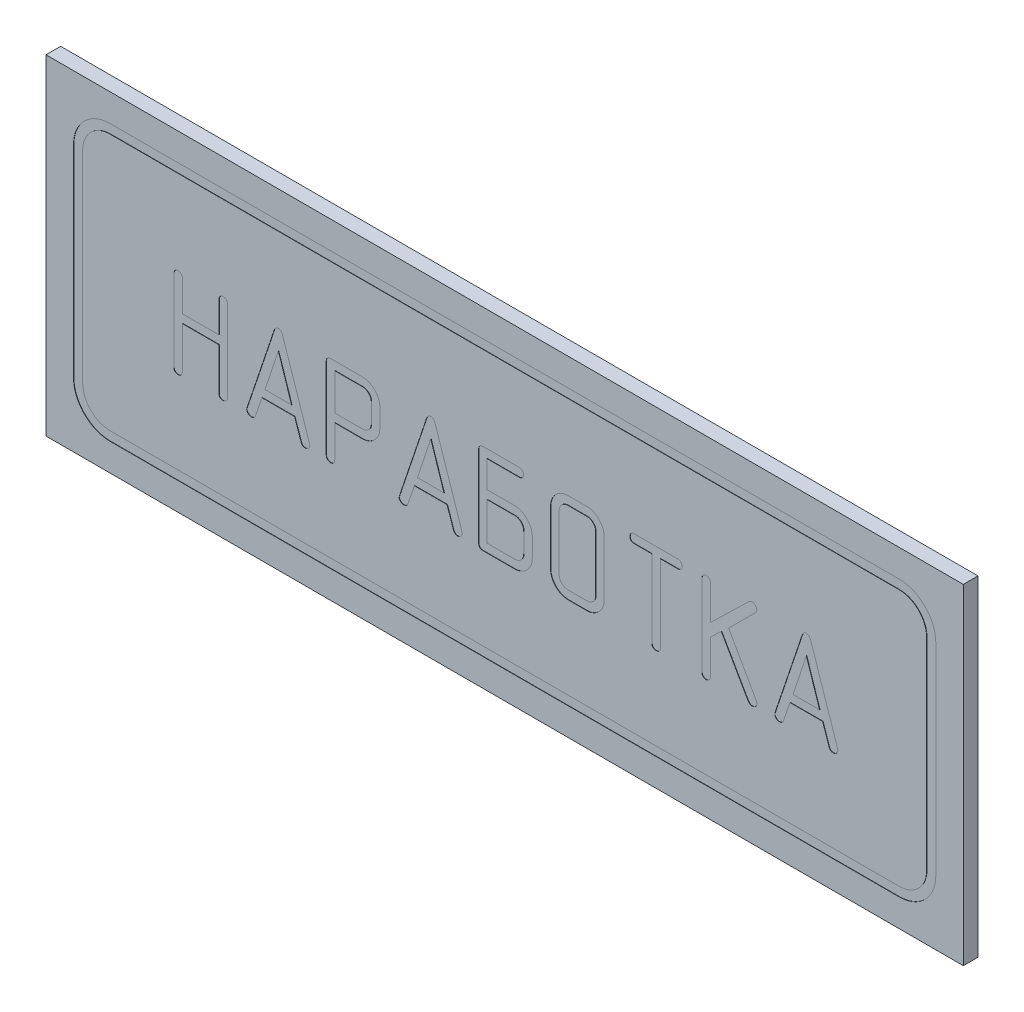
from build123d import *

# Parameters (mm, degrees)
SKETCH_1_W                 = 50
SKETCH_1_H                 = 18
EXTRUDE_1_DEPTH            = 0.8
CUT_EXTRUDE_1_DEPTH        = 0.02
CUT_EXTRUDE_1_2_DEPTH      = 0.02
CUT_EXTRUDE_1_2_DEPTH_BACK = 0.02


with BuildPart() as part:
    # Эскиз1 → Вытянуть1 (new body)
    with BuildSketch(Plane.XY):
        with Locations((25, 9)):
            Rectangle(SKETCH_1_W, SKETCH_1_H)
    extrude(amount=EXTRUDE_1_DEPTH)

    # Эскиз2 → Cut-Extrude 1 (cut)
    # profile 1 of 9: a face of its own
    with BuildSketch(Plane.XY.offset(0.8)):
        with BuildLine():
            Line((9.424559654, 9.491026919), (9.424559654, 11.178672316))
            add(Edge.make_bspline(
                [(9.424559654, 11.178672316), (9.425230619, 11.194361435), (9.426554554, 11.225318933), (9.441016049, 11.269720739), (9.463172562, 11.310878793), (9.493058488, 11.347915035), (9.52907342, 11.378768603), (9.568684269, 11.40202053), (9.611885978, 11.416671576), (9.641846322, 11.417931922), (9.657195081, 11.418577601)],
                knots=[0, 0, 0, 0, 1.015470878, 2.003709671, 2.999333935, 4.038412131, 5.074568827, 6.061528677, 7.006916246, 8, 8, 8, 8], degree=3))
            add(Edge.make_bspline(
                [(9.657195081, 11.418577601), (9.671806604, 11.417713975), (9.700785452, 11.416001157), (9.742750229, 11.40427304), (9.782362537, 11.384761795), (9.819242613, 11.358476614), (9.851420725, 11.323689415), (9.874309812, 11.280087479), (9.888043067, 11.228995795), (9.889214529, 11.192611303), (9.889830508, 11.173479561)],
                knots=[0, 0, 0, 0, 0.924129577, 1.832814461, 2.734077058, 3.706771253, 4.683649099, 5.702831273, 6.792099729, 8, 8, 8, 8], degree=3))
            Line((9.889830508, 11.173479561), (9.889830508, 6.752367896))
            add(Edge.make_bspline(
                [(9.889830508, 6.752367896), (9.889161983, 6.735297536), (9.887843443, 6.701629493), (9.8732574, 6.652769032), (9.850876174, 6.606378576), (9.828485674, 6.579896003), (9.817131938, 6.566467265)],
                knots=[0, 0, 0, 0, 0.999428199, 1.971182286, 2.971230541, 4, 4, 4, 4], degree=3))
            add(Edge.make_bspline(
                [(9.817131938, 6.566467265), (9.803547263, 6.556364856), (9.777768207, 6.537193947), (9.736548908, 6.515948957), (9.695418969, 6.502506484), (9.667674353, 6.500824283), (9.654079428, 6.5)],
                knots=[0, 0, 0, 0, 1.13112399, 2.146485674, 3.091773809, 4, 4, 4, 4], degree=3))
            add(Edge.make_bspline(
                [(9.654079428, 6.5), (9.62522517, 6.502991544), (9.565610901, 6.509172216), (9.516412506, 6.543540845), (9.491026919, 6.56127451)],
                knots=[0, 0, 0, 0, 0.968031924, 2, 2, 2, 2], degree=3))
            add(Edge.make_bspline(
                [(9.491026919, 6.56127451), (9.480645461, 6.572217457), (9.459105187, 6.594922752), (9.439347753, 6.640088561), (9.426443099, 6.692084852), (9.425212974, 6.729422293), (9.424559654, 6.749252243)],
                knots=[0, 0, 0, 0, 0.877029887, 1.819731245, 2.842057225, 4, 4, 4, 4], degree=3))
            Line((9.424559654, 6.749252243), (9.424559654, 9.025756065))
            Line((9.424559654, 9.025756065), (7.430541708, 9.025756065))
            Line((7.430541708, 9.025756065), (7.430541708, 6.752367896))
            add(Edge.make_bspline(
                [(7.430541708, 6.752367896), (7.429808212, 6.733594783), (7.42839134, 6.697331331), (7.415736797, 6.645914549), (7.394956414, 6.5996674), (7.374352326, 6.574052114), (7.364074443, 6.56127451)],
                knots=[0, 0, 0, 0, 1.08719213, 2.100095954, 3.052275931, 4, 4, 4, 4], degree=3))
            add(Edge.make_bspline(
                [(7.364074443, 6.56127451), (7.353033275, 6.551713244), (7.331178486, 6.532787759), (7.290756328, 6.513865257), (7.24597178, 6.502440417), (7.214249791, 6.500829805), (7.197906281, 6.5)],
                knots=[0, 0, 0, 0, 0.96185186, 1.903880948, 2.92005698, 4, 4, 4, 4], degree=3))
            add(Edge.make_bspline(
                [(7.197906281, 6.5), (7.182586406, 6.500791292), (7.152881667, 6.502325581), (7.110073193, 6.514591534), (7.06996603, 6.533223947), (7.033776966, 6.560223677), (7.002520704, 6.594949421), (6.981010906, 6.638772811), (6.966982248, 6.689545166), (6.965860626, 6.725953671), (6.965270854, 6.745098039)],
                knots=[0, 0, 0, 0, 0.965224369, 1.871538615, 2.790145089, 3.742676772, 4.702446452, 5.708824282, 6.795250981, 8, 8, 8, 8], degree=3))
            Line((6.965270854, 6.745098039), (6.965270854, 11.1620555))
            add(Edge.make_bspline(
                [(6.965270854, 11.1620555), (6.965987091, 11.17808376), (6.967429905, 11.210371667), (6.981940178, 11.257357158), (7.003687599, 11.302843998), (7.024299326, 11.329931497), (7.034853772, 11.343801928)],
                knots=[0, 0, 0, 0, 0.966544804, 1.947042782, 2.94876229, 4, 4, 4, 4], degree=3))
            add(Edge.make_bspline(
                [(7.034853772, 11.343801928), (7.046611259, 11.353675097), (7.069669069, 11.37303754), (7.109884442, 11.392688989), (7.152892865, 11.404782934), (7.182590216, 11.406346928), (7.197906281, 11.407153539)],
                knots=[0, 0, 0, 0, 1.025879868, 2.011870596, 2.974645281, 4, 4, 4, 4], degree=3))
            add(Edge.make_bspline(
                [(7.197906281, 11.407153539), (7.212473082, 11.40614918), (7.241275576, 11.404163292), (7.283962735, 11.394501505), (7.322448436, 11.372892208), (7.359977489, 11.348329154), (7.392074618, 11.314363302), (7.415026714, 11.271840511), (7.428758521, 11.221738615), (7.42992694, 11.186034255), (7.430541708, 11.167248255)],
                knots=[0, 0, 0, 0, 0.934259308, 1.847282677, 2.768326902, 3.738884055, 4.710198766, 5.721094328, 6.800944141, 8, 8, 8, 8], degree=3))
            Line((7.430541708, 11.167248255), (7.430541708, 9.491026919))
            Line((7.430541708, 9.491026919), (9.424559654, 9.491026919))
        make_face()
    # profile 2 of 9: a face of its own
    with BuildSketch(Plane.XY.offset(0.8)):
        with BuildLine():
            Line((11.771684945, 7.696410768), (11.41753905, 6.66409106))
            add(Edge.make_bspline(
                [(11.41753905, 6.66409106), (11.406962769, 6.640104595), (11.385775209, 6.592052285), (11.346044654, 6.557705334), (11.32614656, 6.54050349)],
                knots=[0, 0, 0, 0, 0.998348062, 2, 2, 2, 2], degree=3))
            add(Edge.make_bspline(
                [(11.32614656, 6.54050349), (11.307398321, 6.531274628), (11.26536639, 6.510584317), (11.218933593, 6.503773094), (11.193212031, 6.5)],
                knots=[0, 0, 0, 0, 0.892095046, 2, 2, 2, 2], degree=3))
            add(Edge.make_bspline(
                [(11.193212031, 6.5), (11.177181133, 6.500679643), (11.145553818, 6.502020507), (11.100395412, 6.516250083), (11.058540927, 6.538633874), (11.034321216, 6.559063983), (11.021851113, 6.569582918)],
                knots=[0, 0, 0, 0, 1.01257393, 1.997704332, 2.969069762, 4, 4, 4, 4], degree=3))
            add(Edge.make_bspline(
                [(11.021851113, 6.569582918), (11.009484889, 6.580471467), (10.985608309, 6.601494967), (10.959829194, 6.641954612), (10.943515376, 6.687451807), (10.941751587, 6.720028974), (10.940844134, 6.736789631)],
                knots=[0, 0, 0, 0, 1.022890392, 1.974986367, 2.958148861, 4, 4, 4, 4], degree=3))
            Line((10.940844134, 6.736789631), (10.958499501, 6.824027916))
            Line((10.958499501, 6.824027916), (12.434280492, 11.209828847))
            add(Edge.make_bspline(
                [(12.434280492, 11.209828847), (12.447073495, 11.24100291), (12.470465145, 11.298003816), (12.522951067, 11.367932054), (12.590490961, 11.410523876), (12.64007328, 11.415894876), (12.664838817, 11.418577601)],
                knots=[0, 0, 0, 0, 1.213326958, 2.218534511, 3.110187888, 4, 4, 4, 4], degree=3))
            add(Edge.make_bspline(
                [(12.664838817, 11.418577601), (12.689964428, 11.415948454), (12.739924609, 11.410720616), (12.807765941, 11.367929373), (12.860250771, 11.29800469), (12.883642595, 11.241003219), (12.896435693, 11.209828847)],
                knots=[0, 0, 0, 0, 0.899339422, 1.788261434, 2.790389776, 4, 4, 4, 4], degree=3))
            Line((12.896435693, 11.209828847), (14.364946826, 6.824027916))
            Line((14.364946826, 6.824027916), (14.382602193, 6.736789631))
            add(Edge.make_bspline(
                [(14.382602193, 6.736789631), (14.38151305, 6.721453847), (14.379335042, 6.690786189), (14.364196408, 6.645689848), (14.33734589, 6.603823851), (14.313817342, 6.579238407), (14.301595214, 6.566467265)],
                knots=[0, 0, 0, 0, 0.948678786, 1.897115655, 2.907636787, 4, 4, 4, 4], degree=3))
            add(Edge.make_bspline(
                [(14.301595214, 6.566467265), (14.288768687, 6.556279179), (14.263789634, 6.536438368), (14.2211274, 6.515327937), (14.176337423, 6.502447527), (14.145548673, 6.500813011), (14.130234297, 6.5)],
                knots=[0, 0, 0, 0, 1.044588452, 2.034286298, 3.022250655, 4, 4, 4, 4], degree=3))
            add(Edge.make_bspline(
                [(14.130234297, 6.5), (14.112859018, 6.501572019), (14.075291361, 6.504970931), (14.027338489, 6.518689629), (13.987228974, 6.541292188), (13.957953128, 6.57217859), (13.930548479, 6.614061144), (13.914534133, 6.646575647), (13.905907278, 6.66409106)],
                knots=[0, 0, 0, 0, 1.053855164, 2.278574548, 2.982044457, 3.810710099, 4.820639575, 6, 6, 6, 6], degree=3))
            Line((13.905907278, 6.66409106), (13.551761383, 7.696410768))
            Line((13.551761383, 7.696410768), (11.771684945, 7.696410768))
        make_face()
        Polygon((13.386631771, 8.161681622), (12.664838817, 10.355101363), (11.938891658, 8.161681622), align=None, mode=Mode.SUBTRACT)
    # profile 3 of 9: a face of its own
    with BuildSketch(Plane.XY.offset(0.8)):
        with BuildLine():
            Line((15.738949817, 8.494017946), (15.738949817, 6.749252243))
            add(Edge.make_bspline(
                [(15.738949817, 6.749252243), (15.738258549, 6.730467269), (15.736935641, 6.694517668), (15.7239011, 6.643574205), (15.703645483, 6.59773081), (15.682794399, 6.572643045), (15.672482552, 6.560235959)],
                knots=[0, 0, 0, 0, 1.096949031, 2.099277747, 3.060002971, 4, 4, 4, 4], degree=3))
            add(Edge.make_bspline(
                [(15.672482552, 6.560235959), (15.66138872, 6.551090416), (15.639269226, 6.53285553), (15.599200142, 6.513819472), (15.554370008, 6.502453088), (15.52265454, 6.500834113), (15.50631439, 6.5)],
                knots=[0, 0, 0, 0, 0.951182289, 1.896519658, 2.916264364, 4, 4, 4, 4], degree=3))
            add(Edge.make_bspline(
                [(15.50631439, 6.5), (15.490994515, 6.500791292), (15.461289776, 6.502325582), (15.418481299, 6.514591532), (15.37837415, 6.533223952), (15.34218503, 6.560223655), (15.310928984, 6.594949503), (15.289418319, 6.638772476), (15.275300635, 6.689882104), (15.274240919, 6.72664281), (15.273678963, 6.74613659)],
                knots=[0, 0, 0, 0, 0.962602444, 1.866454789, 2.78256597, 3.732510206, 4.689672778, 5.693316895, 6.776792436, 8, 8, 8, 8], degree=3))
            Line((15.273678963, 6.74613659), (15.273678963, 11.17244101))
            add(Edge.make_bspline(
                [(15.273678963, 11.17244101), (15.274446632, 11.191889828), (15.275887644, 11.228397741), (15.287166233, 11.279164576), (15.306226141, 11.322552074), (15.333407333, 11.358422237), (15.368805124, 11.386313572), (15.41208828, 11.405037729), (15.462470327, 11.416307223), (15.498634313, 11.417792815), (15.517738451, 11.418577601)],
                knots=[0, 0, 0, 0, 1.174787525, 2.205226063, 3.123069814, 4.018700482, 4.897801082, 5.815644833, 6.846083372, 8, 8, 8, 8], degree=3))
            Line((15.517738451, 11.418577601), (17.223039216, 11.418577601))
            add(Edge.make_bspline(
                [(17.223039216, 11.418577601), (17.256317621, 11.417866327), (17.322119704, 11.416459912), (17.418896122, 11.402663715), (17.511683906, 11.379685699), (17.600363719, 11.348372687), (17.685722668, 11.308809347), (17.766338678, 11.258542593), (17.843515018, 11.200147895), (17.916034393, 11.133927127), (17.981635515, 11.061120683), (18.039074802, 10.983741817), (18.088419374, 10.903261367), (18.12924358, 10.818894126), (18.160636109, 10.730068377), (18.1818777, 10.637329406), (18.196227834, 10.541448425), (18.197563218, 10.476318891), (18.198238617, 10.443378199)],
                knots=[0, 0, 0, 0, 1.040150937, 2.0567121, 3.049181958, 4.02498047, 4.993546281, 5.985011943, 6.989628837, 8.016398882, 9.05118425, 10.049305898, 11.025884737, 11.99909771, 12.974896222, 13.964824085, 14.970665092, 16, 16, 16, 16], degree=3))
            Line((18.198238617, 10.443378199), (18.198238617, 9.469217348))
            add(Edge.make_bspline(
                [(18.198238617, 9.469217348), (18.197541876, 9.436284843), (18.196171551, 9.371514402), (18.182280204, 9.276103507), (18.158990333, 9.18451968), (18.128644036, 9.09541086), (18.08566506, 9.011619853), (18.037625905, 8.92932779), (17.977244718, 8.852874114), (17.910581415, 8.779631782), (17.837571933, 8.712440888), (17.7595048, 8.654159704), (17.677684851, 8.604904146), (17.592595401, 8.564168413), (17.503346977, 8.53296643), (17.410595576, 8.509916235), (17.313809257, 8.496139679), (17.248008528, 8.494730578), (17.214730808, 8.494017946)],
                knots=[0, 0, 0, 0, 1.02623101, 2.018353406, 2.997356446, 3.970212496, 4.945221414, 5.928083838, 6.936220983, 7.975143232, 9.014065481, 10.02428031, 11.007142734, 11.987156619, 12.960012669, 13.949489793, 14.962985576, 16, 16, 16, 16], degree=3))
            Line((17.214730808, 8.494017946), (15.738949817, 8.494017946))
        make_face()
        with BuildLine():
            Line((15.738949817, 8.9592888), (17.234463277, 8.9592888))
            add(Edge.make_bspline(
                [(17.234463277, 8.9592888), (17.267880159, 8.96069442), (17.333031328, 8.963434883), (17.426728405, 8.990614668), (17.512080846, 9.035230073), (17.588891484, 9.095373354), (17.653611401, 9.169516663), (17.699991395, 9.256549489), (17.728006489, 9.353968984), (17.731271176, 9.422288892), (17.732967763, 9.457793287)],
                knots=[0, 0, 0, 0, 1.016449325, 1.981718699, 2.944447279, 3.936507135, 4.939060545, 5.920968299, 6.919571676, 8, 8, 8, 8], degree=3))
            Line((17.732967763, 9.457793287), (17.732967763, 10.45480226))
            add(Edge.make_bspline(
                [(17.732967763, 10.45480226), (17.731693255, 10.488609655), (17.729204598, 10.554623393), (17.700119913, 10.648773573), (17.656899587, 10.735985759), (17.593485998, 10.810651026), (17.519886987, 10.87489778), (17.433110297, 10.920366407), (17.336898571, 10.948174225), (17.269274376, 10.951562536), (17.234463277, 10.953306746)],
                knots=[0, 0, 0, 0, 1.02750581, 2.006350931, 2.978970947, 3.976537614, 4.972762713, 5.940903496, 6.940033048, 8, 8, 8, 8], degree=3))
            Line((17.234463277, 10.953306746), (15.738949817, 10.953306746))
            Line((15.738949817, 10.953306746), (15.738949817, 8.9592888))
        make_face(mode=Mode.SUBTRACT)
    # profile 4 of 9: a face of its own
    with BuildSketch(Plane.XY.offset(0.8)):
        with BuildLine():
            Line((20.080093054, 7.696410768), (19.725947159, 6.66409106))
            add(Edge.make_bspline(
                [(19.725947159, 6.66409106), (19.715370878, 6.640104595), (19.694183318, 6.592052285), (19.654452763, 6.557705334), (19.634554669, 6.54050349)],
                knots=[0, 0, 0, 0, 0.998348062, 2, 2, 2, 2], degree=3))
            add(Edge.make_bspline(
                [(19.634554669, 6.54050349), (19.61580643, 6.531274628), (19.573774499, 6.510584317), (19.527341702, 6.503773094), (19.50162014, 6.5)],
                knots=[0, 0, 0, 0, 0.892095046, 2, 2, 2, 2], degree=3))
            add(Edge.make_bspline(
                [(19.50162014, 6.5), (19.485589242, 6.500679643), (19.453961927, 6.502020507), (19.408803521, 6.516250083), (19.366949036, 6.538633874), (19.342729325, 6.559063983), (19.330259222, 6.569582918)],
                knots=[0, 0, 0, 0, 1.01257393, 1.997704332, 2.969069762, 4, 4, 4, 4], degree=3))
            add(Edge.make_bspline(
                [(19.330259222, 6.569582918), (19.317892998, 6.580471467), (19.294016418, 6.601494967), (19.268237303, 6.641954612), (19.251923485, 6.687451807), (19.250159696, 6.720028974), (19.249252243, 6.736789631)],
                knots=[0, 0, 0, 0, 1.022890392, 1.974986367, 2.958148861, 4, 4, 4, 4], degree=3))
            Line((19.249252243, 6.736789631), (19.266907611, 6.824027916))
            Line((19.266907611, 6.824027916), (20.742688601, 11.209828847))
            add(Edge.make_bspline(
                [(20.742688601, 11.209828847), (20.755481604, 11.24100291), (20.778873254, 11.298003816), (20.831359176, 11.367932054), (20.89889907, 11.410523876), (20.948481389, 11.415894876), (20.973246926, 11.418577601)],
                knots=[0, 0, 0, 0, 1.213326958, 2.218534511, 3.110187888, 4, 4, 4, 4], degree=3))
            add(Edge.make_bspline(
                [(20.973246926, 11.418577601), (20.998372537, 11.415948454), (21.048332718, 11.410720616), (21.11617405, 11.367929373), (21.16865888, 11.29800469), (21.192050704, 11.241003219), (21.204843802, 11.209828847)],
                knots=[0, 0, 0, 0, 0.899339422, 1.788261434, 2.790389776, 4, 4, 4, 4], degree=3))
            Line((21.204843802, 11.209828847), (22.673354935, 6.824027916))
            Line((22.673354935, 6.824027916), (22.691010302, 6.736789631))
            add(Edge.make_bspline(
                [(22.691010302, 6.736789631), (22.689921159, 6.721453847), (22.687743151, 6.690786189), (22.672604517, 6.645689848), (22.645753999, 6.603823851), (22.622225451, 6.579238407), (22.610003323, 6.566467265)],
                knots=[0, 0, 0, 0, 0.948678786, 1.897115655, 2.907636787, 4, 4, 4, 4], degree=3))
            add(Edge.make_bspline(
                [(22.610003323, 6.566467265), (22.597176796, 6.556279179), (22.572197743, 6.536438368), (22.529535509, 6.515327937), (22.484745532, 6.502447527), (22.453956782, 6.500813011), (22.438642406, 6.5)],
                knots=[0, 0, 0, 0, 1.044588452, 2.034286298, 3.022250655, 4, 4, 4, 4], degree=3))
            add(Edge.make_bspline(
                [(22.438642406, 6.5), (22.421267127, 6.501572019), (22.38369947, 6.504970931), (22.335746598, 6.518689629), (22.295637083, 6.541292188), (22.266361237, 6.57217859), (22.238956588, 6.614061144), (22.222942242, 6.646575647), (22.214315387, 6.66409106)],
                knots=[0, 0, 0, 0, 1.053855164, 2.278574548, 2.982044457, 3.810710099, 4.820639575, 6, 6, 6, 6], degree=3))
            Line((22.214315387, 6.66409106), (21.860169492, 7.696410768))
            Line((21.860169492, 7.696410768), (20.080093054, 7.696410768))
        make_face()
        Polygon((21.69503988, 8.161681622), (20.973246926, 10.355101363), (20.247299767, 8.161681622), align=None, mode=Mode.SUBTRACT)
    # profile 5 of 9: a face of its own
    with BuildSketch(Plane.XY.offset(0.8)):
        with BuildLine():
            Line((24.047357926, 9.491026919), (25.523138917, 9.491026919))
            add(Edge.make_bspline(
                [(25.523138917, 9.491026919), (25.556076061, 9.490341654), (25.620855625, 9.488993899), (25.716200124, 9.474938303), (25.808144451, 9.452230872), (25.896593075, 9.419505786), (25.982254447, 9.379323721), (26.063772102, 9.328715903), (26.141951454, 9.26919043), (26.215824921, 9.201235053), (26.28370407, 9.127336415), (26.343725725, 9.049091952), (26.393536043, 8.96626643), (26.435882919, 8.880166538), (26.466651078, 8.788803025), (26.489392242, 8.693931019), (26.504869455, 8.595260556), (26.506050135, 8.528002898), (26.506646726, 8.494017946)],
                knots=[0, 0, 0, 0, 1.015136754, 1.996533632, 2.964952983, 3.930897514, 4.900316782, 5.87810664, 6.883824193, 7.926598939, 8.969373685, 9.975091237, 10.961989424, 11.945648457, 12.928148061, 13.927669877, 14.952862161, 16, 16, 16, 16], degree=3))
            Line((26.506646726, 8.494017946), (26.506646726, 7.497008973))
            add(Edge.make_bspline(
                [(26.506646726, 7.497008973), (26.505956814, 7.463381833), (26.504599575, 7.397228419), (26.490603318, 7.299799203), (26.467798547, 7.206286741), (26.436222837, 7.116340072), (26.396941189, 7.029169049), (26.346644824, 6.946478143), (26.288252045, 6.867245606), (26.222114722, 6.792549068), (26.148833209, 6.725153759), (26.072507913, 6.664200887), (25.991287394, 6.614103095), (25.907033554, 6.572107265), (25.818187279, 6.539676543), (25.725441589, 6.517470183), (25.629603162, 6.501733449), (25.564399872, 6.500581948), (25.531447325, 6.5)],
                knots=[0, 0, 0, 0, 1.040842045, 2.047609564, 3.040929158, 4.017443261, 4.996132558, 5.99637111, 7.008490481, 8.041295016, 9.080589833, 10.08861246, 11.061411662, 12.029947816, 12.999966318, 13.982874629, 14.980581801, 16, 16, 16, 16], degree=3))
            Line((25.531447325, 6.5), (23.82614656, 6.5))
            add(Edge.make_bspline(
                [(23.82614656, 6.5), (23.807042422, 6.500784785), (23.770878436, 6.502270378), (23.720496389, 6.513539872), (23.677213233, 6.532264028), (23.641815442, 6.560155364), (23.61463425, 6.596025527), (23.595574342, 6.639413025), (23.584295753, 6.690179859), (23.582854741, 6.726687772), (23.582087072, 6.74613659)],
                knots=[0, 0, 0, 0, 1.153916628, 2.184355167, 3.102198918, 3.981299518, 4.876930186, 5.794773937, 6.825212475, 8, 8, 8, 8], degree=3))
            Line((23.582087072, 6.74613659), (23.582087072, 11.17244101))
            add(Edge.make_bspline(
                [(23.582087072, 11.17244101), (23.582854629, 11.19189009), (23.584295432, 11.228398493), (23.595575396, 11.279162112), (23.614630799, 11.322560145), (23.641827933, 11.358393025), (23.677417632, 11.386621513), (23.721302327, 11.404790047), (23.771893896, 11.41636003), (23.808072991, 11.417811069), (23.827185111, 11.418577601)],
                knots=[0, 0, 0, 0, 1.171986281, 2.199967772, 3.115622954, 4.009118019, 4.886122432, 5.820853358, 6.848834849, 8, 8, 8, 8], degree=3))
            Line((23.827185111, 11.418577601), (25.790046527, 11.418577601))
            add(Edge.make_bspline(
                [(25.790046527, 11.418577601), (25.806409627, 11.417877326), (25.838688458, 11.416495923), (25.885194362, 11.402526121), (25.927284466, 11.379074741), (25.964602373, 11.347996866), (25.994697998, 11.311199735), (26.01889373, 11.27221731), (26.032963302, 11.229806618), (26.034416727, 11.200578753), (26.035144566, 11.185942173)],
                knots=[0, 0, 0, 0, 1.049035914, 2.069391155, 3.084643979, 4.126821057, 5.168998136, 6.1263312, 7.061713754, 8, 8, 8, 8], degree=3))
            add(Edge.make_bspline(
                [(26.035144566, 11.185942173), (26.031744869, 11.159090688), (26.024506691, 11.101922134), (25.983933375, 11.038018412), (25.938764412, 10.994161363), (25.894844608, 10.969602034), (25.843071823, 10.956354212), (25.806393821, 10.954363242), (25.786930874, 10.953306746)],
                knots=[0, 0, 0, 0, 1.274870288, 2.714281576, 3.482672865, 4.256333186, 5.074734361, 6, 6, 6, 6], degree=3))
            Line((25.786930874, 10.953306746), (24.047357926, 10.953306746))
            Line((24.047357926, 10.953306746), (24.047357926, 9.491026919))
        make_face()
        with BuildLine():
            Line((24.047357926, 9.025756065), (24.047357926, 6.965270854))
            Line((24.047357926, 6.965270854), (25.542871386, 6.965270854))
            add(Edge.make_bspline(
                [(25.542871386, 6.965270854), (25.576306606, 6.96701761), (25.641560995, 6.970426694), (25.735189523, 6.998762483), (25.820883167, 7.044303891), (25.897326587, 7.10673668), (25.962433936, 7.183020889), (26.008381709, 7.27307597), (26.036411314, 7.373495582), (26.039678854, 7.443852051), (26.041375872, 7.480392157)],
                knots=[0, 0, 0, 0, 1.001355613, 1.954311872, 2.906702074, 3.896084438, 4.898677921, 5.892682449, 6.905550428, 8, 8, 8, 8], degree=3))
            Line((26.041375872, 7.480392157), (26.041375872, 8.510634762))
            add(Edge.make_bspline(
                [(26.041375872, 8.510634762), (26.040027455, 8.545446649), (26.037381073, 8.613767936), (26.009305648, 8.711075972), (25.96469699, 8.800279609), (25.902410676, 8.877811303), (25.828347074, 8.94399721), (25.741911265, 8.991890948), (25.645434231, 9.020825551), (25.577692879, 9.024082088), (25.542871386, 9.025756065)],
                knots=[0, 0, 0, 0, 1.041747408, 2.044517874, 3.010480817, 4.015989705, 5.009469057, 5.971685018, 6.957373109, 8, 8, 8, 8], degree=3))
            Line((25.542871386, 9.025756065), (24.047357926, 9.025756065))
        make_face(mode=Mode.SUBTRACT)
    # profile 6 of 9: a face of its own
    with BuildSketch(Plane.XY.offset(0.8)):
        with BuildLine():
            add(Edge.make_bspline(
                [(30.428215354, 7.48350781), (30.427516924, 7.450228514), (30.426143101, 7.384767657), (30.412320327, 7.288673599), (30.389175821, 7.196627011), (30.357805664, 7.108010017), (30.318485822, 7.021878151), (30.268196345, 6.940227237), (30.209799531, 6.862028073), (30.143641678, 6.788395316), (30.070438755, 6.721921487), (29.993716579, 6.662278447), (29.913172928, 6.611752194), (29.828305383, 6.571307441), (29.739784952, 6.538646443), (29.647100312, 6.516106858), (29.551072599, 6.502079509), (29.485952083, 6.500698484), (29.453015952, 6.5)],
                knots=[0, 0, 0, 0, 1.037122832, 2.040035617, 3.019141001, 3.992098752, 4.967627701, 5.965415826, 6.975736262, 8.007509145, 9.046540002, 10.054782536, 11.034185367, 12.004565107, 12.981168362, 13.970748924, 14.973661709, 16, 16, 16, 16], degree=3))
            Line((29.453015952, 6.5), (28.478855101, 6.5))
            add(Edge.make_bspline(
                [(28.478855101, 6.5), (28.446269403, 6.500715269), (28.381846517, 6.502129377), (28.287115722, 6.515863044), (28.195833769, 6.539237278), (28.10778843, 6.570225599), (28.022538763, 6.609441677), (27.942558855, 6.660666653), (27.864588939, 6.718329687), (27.791043932, 6.784613726), (27.724285209, 6.857908154), (27.664728456, 6.935270235), (27.615574844, 7.017460918), (27.57488756, 7.103002412), (27.542318421, 7.192612374), (27.519757006, 7.286314525), (27.50568772, 7.383722947), (27.504340513, 7.449879217), (27.5036557, 7.48350781)],
                knots=[0, 0, 0, 0, 1.015308535, 2.007294869, 2.975697998, 3.948420628, 4.913933354, 5.893099506, 6.903175791, 7.93469934, 8.973479108, 9.990048541, 10.972776172, 11.952655656, 12.939168026, 13.938988876, 14.952345666, 16, 16, 16, 16], degree=3))
            Line((27.5036557, 7.48350781), (27.5036557, 10.435069791))
            add(Edge.make_bspline(
                [(27.5036557, 10.435069791), (27.504316674, 10.468703194), (27.505616983, 10.534868927), (27.520015865, 10.63212872), (27.54125895, 10.72589661), (27.572633347, 10.815764481), (27.613498272, 10.901138878), (27.662522066, 10.982536543), (27.720249729, 11.060106164), (27.786186898, 11.132885174), (27.858075138, 11.200094959), (27.935241012, 11.258758639), (28.016764189, 11.307352672), (28.101204259, 11.348697255), (28.190261199, 11.379583553), (28.282984196, 11.402691872), (28.379778244, 11.41645261), (28.445577916, 11.417863875), (28.478855101, 11.418577601)],
                knots=[0, 0, 0, 0, 1.045837316, 2.057436573, 3.05302036, 4.034221007, 5.012401019, 5.993424239, 6.986673985, 8.016408493, 9.045466582, 10.04517987, 11.026203091, 11.994665743, 12.965701314, 13.953326856, 14.964926113, 16, 16, 16, 16], degree=3))
            Line((28.478855101, 11.418577601), (29.453015952, 11.418577601))
            add(Edge.make_bspline(
                [(29.453015952, 11.418577601), (29.486292096, 11.417861799), (29.552089708, 11.416446431), (29.648898817, 11.402715701), (29.741566469, 11.379497106), (29.830969683, 11.348964701), (29.914778134, 11.306018535), (29.997024104, 11.257924596), (30.073449948, 11.197893766), (30.145690061, 11.130846768), (30.211977522, 11.057937242), (30.26901757, 10.979526354), (30.318444625, 10.898066834), (30.358994886, 10.812901665), (30.390635854, 10.723850974), (30.411962446, 10.630764905), (30.426188664, 10.534171336), (30.427534645, 10.468355268), (30.428215354, 10.435069791)],
                knots=[0, 0, 0, 0, 1.035817767, 2.048144033, 3.036479355, 4.008212784, 4.982096596, 5.963824851, 6.970798663, 8.000596308, 9.031070859, 10.033707362, 11.015435617, 11.994318621, 12.966052049, 13.951855967, 14.964182233, 16, 16, 16, 16], degree=3))
            Line((30.428215354, 10.435069791), (30.428215354, 7.48350781))
        make_face()
        with BuildLine():
            Line((29.9629445, 7.463775341), (29.9629445, 10.45480226))
            add(Edge.make_bspline(
                [(29.9629445, 10.45480226), (29.961669992, 10.488609655), (29.959181334, 10.554623393), (29.93009665, 10.648773573), (29.886876323, 10.735985759), (29.823462735, 10.810651026), (29.749863723, 10.87489778), (29.663087034, 10.920366407), (29.566875307, 10.948174225), (29.499251112, 10.951562536), (29.464440013, 10.953306746)],
                knots=[0, 0, 0, 0, 1.02750581, 2.006350931, 2.978970947, 3.976537614, 4.972762713, 5.940903496, 6.940033048, 8, 8, 8, 8], degree=3))
            Line((29.464440013, 10.953306746), (28.46743104, 10.953306746))
            add(Edge.make_bspline(
                [(28.46743104, 10.953306746), (28.433680413, 10.95142101), (28.367568077, 10.94772714), (28.272297454, 10.921213482), (28.184939803, 10.876067305), (28.136017725, 10.832910976), (28.111208043, 10.811025258)],
                knots=[0, 0, 0, 0, 1.029004864, 2.015663768, 2.993690518, 4, 4, 4, 4], degree=3))
            add(Edge.make_bspline(
                [(28.111208043, 10.811025258), (28.089278864, 10.786237489), (28.045832713, 10.737127894), (28.001272714, 10.649107154), (27.974560263, 10.553984606), (27.970824225, 10.488211061), (27.968926554, 10.45480226)],
                knots=[0, 0, 0, 0, 1.00659897, 1.994276692, 2.98121943, 4, 4, 4, 4], degree=3))
            Line((27.968926554, 10.45480226), (27.968926554, 7.463775341))
            add(Edge.make_bspline(
                [(27.968926554, 7.463775341), (27.97081229, 7.430024714), (27.97450616, 7.363912377), (28.001019818, 7.268641755), (28.046165995, 7.181284103), (28.089322324, 7.132362025), (28.111208043, 7.107552343)],
                knots=[0, 0, 0, 0, 1.029004864, 2.015663768, 2.993690518, 4, 4, 4, 4], degree=3))
            add(Edge.make_bspline(
                [(28.111208043, 7.107552343), (28.136609, 7.0869767), (28.186659881, 7.046433777), (28.243266361, 7.015711987), (28.271144899, 7.000581589)],
                knots=[0, 0, 0, 0, 1.015005409, 2, 2, 2, 2], degree=3))
            add(Edge.make_bspline(
                [(28.271144899, 7.000581589), (28.305178342, 6.990564901), (28.369359212, 6.971675254), (28.436087177, 6.967317707), (28.46743104, 6.965270854)],
                knots=[0, 0, 0, 0, 1.06054792, 2, 2, 2, 2], degree=3))
            Line((28.46743104, 6.965270854), (29.464440013, 6.965270854))
            add(Edge.make_bspline(
                [(29.464440013, 6.965270854), (29.497856896, 6.966676473), (29.563008064, 6.969416937), (29.656705141, 6.996596722), (29.742057582, 7.041212126), (29.81886822, 7.101355408), (29.883588138, 7.175498717), (29.929968132, 7.262531543), (29.957983225, 7.359951038), (29.961247912, 7.428270945), (29.9629445, 7.463775341)],
                knots=[0, 0, 0, 0, 1.016449325, 1.981718699, 2.944447279, 3.936507135, 4.939060545, 5.920968299, 6.919571676, 8, 8, 8, 8], degree=3))
        make_face(mode=Mode.SUBTRACT)
    # profile 7 of 9: a face of its own
    with BuildSketch(Plane.XY.offset(0.8)):
        with BuildLine():
            Line((33.020438684, 10.953306746), (32.062894649, 10.953306746))
            add(Edge.make_bspline(
                [(32.062894649, 10.953306746), (32.045508252, 10.954106073), (32.012064678, 10.955643615), (31.964216347, 10.967442742), (31.920693174, 10.986545218), (31.897012415, 11.006694609), (31.885302426, 11.016658358)],
                knots=[0, 0, 0, 0, 1.079416544, 2.076309691, 3.048747018, 4, 4, 4, 4], degree=3))
            add(Edge.make_bspline(
                [(31.885302426, 11.016658358), (31.875806575, 11.029510391), (31.857452143, 11.054351951), (31.838399513, 11.096364262), (31.826582113, 11.140288239), (31.824884257, 11.170635869), (31.824027916, 11.185942173)],
                knots=[0, 0, 0, 0, 1.042916738, 2.015842924, 2.999259183, 4, 4, 4, 4], degree=3))
            add(Edge.make_bspline(
                [(31.824027916, 11.185942173), (31.827079325, 11.212753809), (31.833510169, 11.269259345), (31.872427261, 11.333141752), (31.916353378, 11.376128801), (31.957877888, 11.402790717), (32.008222584, 11.415215813), (32.043463401, 11.417424733), (32.061856098, 11.418577601)],
                knots=[0, 0, 0, 0, 1.300166254, 2.740100978, 3.513473502, 4.283912407, 5.104348798, 6, 6, 6, 6], degree=3))
            Line((32.061856098, 11.418577601), (34.444292124, 11.418577601))
            add(Edge.make_bspline(
                [(34.444292124, 11.418577601), (34.460323598, 11.41792076), (34.491620035, 11.416638484), (34.536631659, 11.402263105), (34.577430946, 11.379060019), (34.6136743, 11.347929227), (34.64286668, 11.311204605), (34.66570333, 11.271928361), (34.679994393, 11.229836974), (34.681410936, 11.200588883), (34.682120306, 11.185942173)],
                knots=[0, 0, 0, 0, 1.043365491, 2.036844728, 3.048657267, 4.090308507, 5.13489674, 6.096248124, 7.046648906, 8, 8, 8, 8], degree=3))
            add(Edge.make_bspline(
                [(34.682120306, 11.185942173), (34.679126518, 11.159071398), (34.672764121, 11.101965626), (34.632626861, 11.038816782), (34.590077066, 10.994234541), (34.54786712, 10.969388061), (34.497653648, 10.956479441), (34.462017367, 10.954401079), (34.443253573, 10.953306746)],
                knots=[0, 0, 0, 0, 1.296042091, 2.754348639, 3.513317893, 4.272657647, 5.090491591, 6, 6, 6, 6], degree=3))
            Line((34.443253573, 10.953306746), (33.485709538, 10.953306746))
            Line((33.485709538, 10.953306746), (33.485709538, 6.747175141))
            add(Edge.make_bspline(
                [(33.485709538, 6.747175141), (33.484976751, 6.728746768), (33.483561823, 6.693163682), (33.47090824, 6.642762396), (33.450091133, 6.59753945), (33.429516489, 6.57265989), (33.419242273, 6.560235959)],
                knots=[0, 0, 0, 0, 1.08722023, 2.099298278, 3.050859919, 4, 4, 4, 4], degree=3))
            add(Edge.make_bspline(
                [(33.419242273, 6.560235959), (33.408148441, 6.551090416), (33.386028947, 6.53285553), (33.345959863, 6.513819472), (33.301129729, 6.502453088), (33.269414261, 6.500834113), (33.253074111, 6.5)],
                knots=[0, 0, 0, 0, 0.951182289, 1.896519658, 2.916264364, 4, 4, 4, 4], degree=3))
            add(Edge.make_bspline(
                [(33.253074111, 6.5), (33.237755262, 6.500792171), (33.208052513, 6.502328166), (33.165229747, 6.514581874), (33.125177549, 6.533261375), (33.088562075, 6.560234225), (33.058019, 6.59593377), (33.036115362, 6.639757453), (33.022078968, 6.690936563), (33.021007089, 6.727686874), (33.020438684, 6.747175141)],
                knots=[0, 0, 0, 0, 0.960624492, 1.862619603, 2.776848362, 3.724840655, 4.696474829, 5.698056661, 6.779305879, 8, 8, 8, 8], degree=3))
            Line((33.020438684, 6.747175141), (33.020438684, 10.953306746))
        make_face()
    # profile 8 of 9: a face of its own
    with BuildSketch(Plane.XY.offset(0.8)):
        with BuildLine():
            Line((36.210867398, 9.302010635), (38.318087404, 11.352110336))
            add(Edge.make_bspline(
                [(38.318087404, 11.352110336), (38.330542361, 11.362331179), (38.355001572, 11.38240301), (38.397543493, 11.403212068), (38.442634624, 11.416239252), (38.473781984, 11.417795065), (38.489448322, 11.418577601)],
                knots=[0, 0, 0, 0, 1.025751183, 2.014383971, 3.001285135, 4, 4, 4, 4], degree=3))
            add(Edge.make_bspline(
                [(38.489448322, 11.418577601), (38.504759287, 11.417385992), (38.535602144, 11.414985581), (38.581232595, 11.401294789), (38.624188446, 11.376469903), (38.663943713, 11.343567828), (38.698338682, 11.305153719), (38.726338424, 11.262838102), (38.740506798, 11.215191793), (38.742763382, 11.182552941), (38.74389332, 11.166209704)],
                knots=[0, 0, 0, 0, 0.934203003, 1.8818859, 2.873627656, 3.937884265, 5.01357923, 6.008680934, 7.002887762, 8, 8, 8, 8], degree=3))
            add(Edge.make_bspline(
                [(38.74389332, 11.166209704), (38.743103876, 11.154649843), (38.741374932, 11.129332825), (38.72437551, 11.090754446), (38.701833073, 11.046659052), (38.681301749, 11.017117111), (38.670156198, 11.001080093)],
                knots=[0, 0, 0, 0, 0.75327487, 1.649731969, 2.724143087, 4, 4, 4, 4], degree=3))
            Line((38.670156198, 11.001080093), (37.207876371, 9.539838817))
            Line((37.207876371, 9.539838817), (38.714813892, 6.86868561))
            Line((38.714813892, 6.86868561), (38.750124626, 6.738866733))
            add(Edge.make_bspline(
                [(38.750124626, 6.738866733), (38.749198988, 6.723466427), (38.747360785, 6.692883316), (38.730076881, 6.649401504), (38.705603051, 6.607446646), (38.680907103, 6.585261121), (38.668079096, 6.573737122)],
                knots=[0, 0, 0, 0, 0.966715818, 1.919778525, 2.919454473, 4, 4, 4, 4], degree=3))
            add(Edge.make_bspline(
                [(38.668079096, 6.573737122), (38.655361829, 6.562377272), (38.630349397, 6.540034617), (38.585256081, 6.517477705), (38.536904579, 6.50162439), (38.50273832, 6.50054904), (38.485294118, 6.5)],
                knots=[0, 0, 0, 0, 1.007531264, 1.981621398, 2.969480274, 4, 4, 4, 4], degree=3))
            add(Edge.make_bspline(
                [(38.485294118, 6.5), (38.46528818, 6.501597156), (38.425519325, 6.504772066), (38.368999596, 6.531188765), (38.316982698, 6.572766506), (38.289223721, 6.610017745), (38.274468262, 6.629818877)],
                knots=[0, 0, 0, 0, 0.927963832, 1.844655289, 2.854312906, 4, 4, 4, 4], degree=3))
            Line((38.274468262, 6.629818877), (36.808034231, 9.188808574))
            Line((36.808034231, 9.188808574), (36.210867398, 8.613451313))
            Line((36.210867398, 8.613451313), (36.210867398, 6.745098039))
            add(Edge.make_bspline(
                [(36.210867398, 6.745098039), (36.21017347, 6.726660479), (36.208846234, 6.691395976), (36.195861081, 6.641431383), (36.175264489, 6.596497116), (36.15467951, 6.571620079), (36.144400133, 6.559197408)],
                knots=[0, 0, 0, 0, 1.092637599, 2.089827516, 3.046130571, 4, 4, 4, 4], degree=3))
            add(Edge.make_bspline(
                [(36.144400133, 6.559197408), (36.1332998, 6.550078409), (36.111167345, 6.531896447), (36.071272237, 6.512491314), (36.0261182, 6.502804671), (35.994542413, 6.500955294), (35.978231971, 6.5)],
                knots=[0, 0, 0, 0, 0.952479984, 1.899107072, 2.914785828, 4, 4, 4, 4], degree=3))
            add(Edge.make_bspline(
                [(35.978231971, 6.5), (35.962913122, 6.500792171), (35.933210372, 6.502328165), (35.890387609, 6.514581875), (35.850335398, 6.53326137), (35.813719977, 6.560234245), (35.783176695, 6.595933694), (35.76127388, 6.639757756), (35.747326177, 6.690599308), (35.746192602, 6.726997595), (35.745596544, 6.74613659)],
                knots=[0, 0, 0, 0, 0.963235638, 1.86768253, 2.784396324, 3.734965427, 4.709240672, 5.71354498, 6.797733224, 8, 8, 8, 8], degree=3))
            Line((35.745596544, 6.74613659), (35.745596544, 11.179710867))
            add(Edge.make_bspline(
                [(35.745596544, 11.179710867), (35.746331885, 11.195032085), (35.747798979, 11.225599772), (35.761614523, 11.269799557), (35.785703262, 11.310043109), (35.81644476, 11.346982446), (35.852636987, 11.378195154), (35.891993294, 11.402281305), (35.934358467, 11.416407631), (35.963592368, 11.417853531), (35.978231971, 11.418577601)],
                knots=[0, 0, 0, 0, 0.999236149, 1.99359732, 2.986671625, 4.046521611, 5.120990907, 6.094558121, 7.045802594, 8, 8, 8, 8], degree=3))
            add(Edge.make_bspline(
                [(35.978231971, 11.418577601), (36.007399465, 11.416364977), (36.06659554, 11.411874408), (36.116147898, 11.379114214), (36.14128448, 11.362495846)],
                knots=[0, 0, 0, 0, 0.985453645, 2, 2, 2, 2], degree=3))
            add(Edge.make_bspline(
                [(36.14128448, 11.362495846), (36.151988007, 11.351556149), (36.173914845, 11.329145504), (36.194829514, 11.28518939), (36.209224275, 11.23532418), (36.210300918, 11.199564516), (36.210867398, 11.180749418)],
                knots=[0, 0, 0, 0, 0.910929471, 1.866095324, 2.877237029, 4, 4, 4, 4], degree=3))
            Line((36.210867398, 11.180749418), (36.210867398, 9.302010635))
        make_face()
    # profile 9 of 9: a face of its own
    with BuildSketch(Plane.XY.offset(0.8)):
        with BuildLine():
            Line((40.552010635, 7.696410768), (40.197864739, 6.66409106))
            add(Edge.make_bspline(
                [(40.197864739, 6.66409106), (40.187288459, 6.640104595), (40.166100898, 6.592052285), (40.126370344, 6.557705334), (40.10647225, 6.54050349)],
                knots=[0, 0, 0, 0, 0.998348062, 2, 2, 2, 2], degree=3))
            add(Edge.make_bspline(
                [(40.10647225, 6.54050349), (40.087724011, 6.531274628), (40.04569208, 6.510584317), (39.999259283, 6.503773094), (39.97353772, 6.5)],
                knots=[0, 0, 0, 0, 0.892095046, 2, 2, 2, 2], degree=3))
            add(Edge.make_bspline(
                [(39.97353772, 6.5), (39.957506822, 6.500679643), (39.925879508, 6.502020507), (39.880721102, 6.516250083), (39.838866616, 6.538633874), (39.814646905, 6.559063983), (39.802176803, 6.569582918)],
                knots=[0, 0, 0, 0, 1.01257393, 1.997704332, 2.969069762, 4, 4, 4, 4], degree=3))
            add(Edge.make_bspline(
                [(39.802176803, 6.569582918), (39.789810579, 6.580471467), (39.765933999, 6.601494967), (39.740154884, 6.641954612), (39.723841065, 6.687451807), (39.722077277, 6.720028974), (39.721169824, 6.736789631)],
                knots=[0, 0, 0, 0, 1.022890392, 1.974986367, 2.958148861, 4, 4, 4, 4], degree=3))
            Line((39.721169824, 6.736789631), (39.738825191, 6.824027916))
            Line((39.738825191, 6.824027916), (41.214606181, 11.209828847))
            add(Edge.make_bspline(
                [(41.214606181, 11.209828847), (41.227399185, 11.24100291), (41.250790835, 11.298003816), (41.303276756, 11.367932054), (41.37081665, 11.410523876), (41.42039897, 11.415894876), (41.445164506, 11.418577601)],
                knots=[0, 0, 0, 0, 1.213326958, 2.218534511, 3.110187888, 4, 4, 4, 4], degree=3))
            add(Edge.make_bspline(
                [(41.445164506, 11.418577601), (41.470290117, 11.415948454), (41.520250299, 11.410720616), (41.588091631, 11.367929373), (41.640576461, 11.29800469), (41.663968284, 11.241003219), (41.676761383, 11.209828847)],
                knots=[0, 0, 0, 0, 0.899339422, 1.788261434, 2.790389776, 4, 4, 4, 4], degree=3))
            Line((41.676761383, 11.209828847), (43.145272516, 6.824027916))
            Line((43.145272516, 6.824027916), (43.162927883, 6.736789631))
            add(Edge.make_bspline(
                [(43.162927883, 6.736789631), (43.16183874, 6.721453847), (43.159660731, 6.690786189), (43.144522098, 6.645689848), (43.11767158, 6.603823851), (43.094143031, 6.579238407), (43.081920904, 6.566467265)],
                knots=[0, 0, 0, 0, 0.948678786, 1.897115655, 2.907636787, 4, 4, 4, 4], degree=3))
            add(Edge.make_bspline(
                [(43.081920904, 6.566467265), (43.069094376, 6.556279179), (43.044115324, 6.536438368), (43.00145309, 6.515327937), (42.956663112, 6.502447527), (42.925874363, 6.500813011), (42.910559987, 6.5)],
                knots=[0, 0, 0, 0, 1.044588452, 2.034286298, 3.022250655, 4, 4, 4, 4], degree=3))
            add(Edge.make_bspline(
                [(42.910559987, 6.5), (42.893184707, 6.501572019), (42.85561705, 6.504970931), (42.807664178, 6.518689629), (42.767554663, 6.541292188), (42.738278818, 6.57217859), (42.710874169, 6.614061144), (42.694859822, 6.646575647), (42.686232968, 6.66409106)],
                knots=[0, 0, 0, 0, 1.053855164, 2.278574548, 2.982044457, 3.810710099, 4.820639575, 6, 6, 6, 6], degree=3))
            Line((42.686232968, 6.66409106), (42.332087072, 7.696410768))
            Line((42.332087072, 7.696410768), (40.552010635, 7.696410768))
        make_face()
        Polygon((42.166957461, 8.161681622), (41.445164506, 10.355101363), (40.719217348, 8.161681622), align=None, mode=Mode.SUBTRACT)
    extrude(amount=-CUT_EXTRUDE_1_DEPTH, mode=Mode.SUBTRACT)

    # Эскиз3 → Cut-Extrude 1 2 (cut, two sides: drawn at the far end of the back side and taken through both)
    with BuildSketch(Plane.XY.offset(0.8).offset(-CUT_EXTRUDE_1_2_DEPTH_BACK)):
        with BuildLine():
            Line((3.5, 1.5), (46.5, 1.5))
            ThreePointArc((46.5, 1.5), (47.914213562, 2.085786438), (48.5, 3.5))
            Line((48.5, 3.5), (48.5, 14.5))
            ThreePointArc((48.5, 14.5), (47.914213562, 15.914213562), (46.5, 16.5))
            Line((46.5, 16.5), (3.5, 16.5))
            ThreePointArc((3.5, 16.5), (2.085786438, 15.914213562), (1.5, 14.5))
            Line((1.5, 14.5), (1.5, 3.5))
            ThreePointArc((1.5, 3.5), (2.085786438, 2.085786438), (3.5, 1.5))
        make_face()
        with BuildLine():
            Line((3.5, 2), (46.5, 2))
            ThreePointArc((46.5, 2), (47.560660172, 2.439339828), (48, 3.5))
            Line((48, 3.5), (48, 14.5))
            ThreePointArc((48, 14.5), (47.560660172, 15.560660172), (46.5, 16))
            Line((46.5, 16), (3.5, 16))
            ThreePointArc((3.5, 16), (2.439339828, 15.560660172), (2, 14.5))
            Line((2, 14.5), (2, 3.5))
            ThreePointArc((2, 3.5), (2.439339828, 2.439339828), (3.5, 2))
        make_face(mode=Mode.SUBTRACT)
    extrude(amount=CUT_EXTRUDE_1_2_DEPTH + CUT_EXTRUDE_1_2_DEPTH_BACK, mode=Mode.SUBTRACT)


solid = part.part
